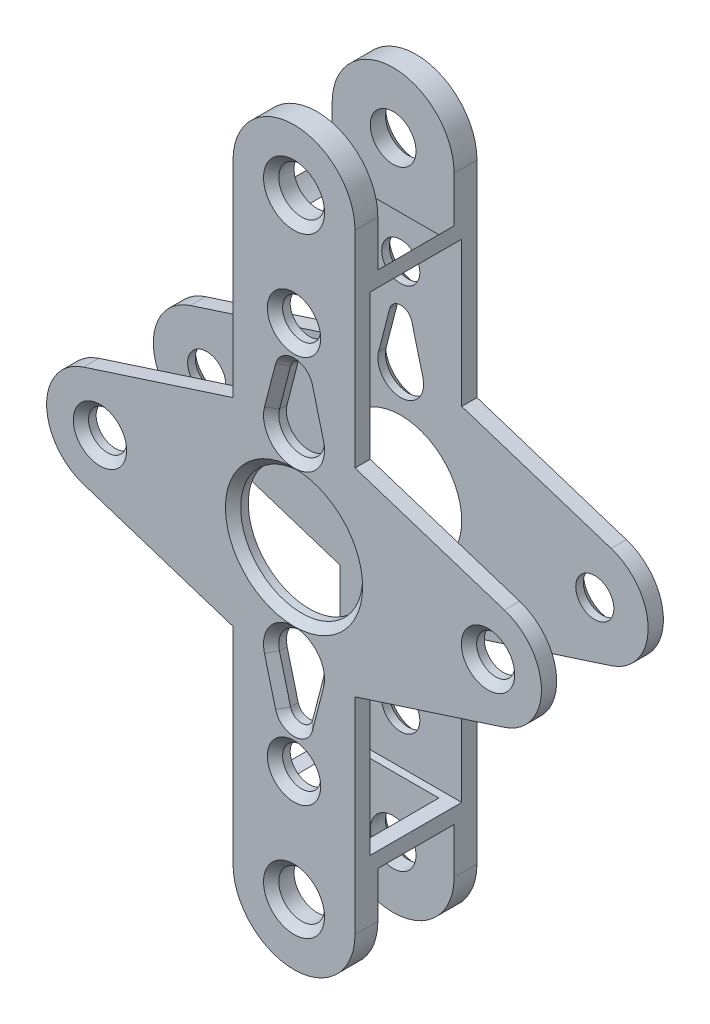
from build123d import *

# Parameters (mm, degrees)
SKETCH_1_R               = 1.25
SKETCH_1_R_2             = 1.5
EXTRUDE_1_DEPTH          = 4
SKETCH_2_R               = 4
CUT_EXTRUDE_1_DEPTH      = 31.055705855
CHAMFER_1_SIZE           = 0.5
SKETCH_3_R               = 5
CUT_EXTRUDE_2_DEPTH      = 2.5
CUT_EXTRUDE_4_DEPTH      = 30.246289584
CUT_EXTRUDE_4_DEPTH_BACK = 30.246289584
SKETCH_7_W               = 6
SKETCH_7_H               = 32


with BuildPart() as part:
    # 草图1 → 凸台-拉伸1 (new, symmetric)
    with BuildSketch(Plane.XY):
        with BuildLine():
            Line((-4, 20), (-4, 6.5))
            Line((-4, 6.5), (-13.804568476, 3.330290152))
            ThreePointArc((-13.804568476, 3.330290152), (-16.227922061, 0), (-13.804568476, -3.330290152))
            Line((-13.804568476, -3.330290152), (-4, -6.5))
            Line((-4, -6.5), (-4, -20))
            ThreePointArc((-4, -20), (0, -24), (4, -20))
            Line((4, -20), (4, -6.5))
            Line((4, -6.5), (13.804568476, -3.330290152))
            ThreePointArc((13.804568476, -3.330290152), (16.227922061, 0), (13.804568476, 3.330290152))
            Line((13.804568476, 3.330290152), (4, 6.5))
            Line((4, 6.5), (4, 20))
            ThreePointArc((4, 20), (0, 24), (-4, 20))
        make_face()
        with Locations((0, 12.727922061)):
            Circle(SKETCH_1_R, mode=Mode.SUBTRACT)
        with Locations((0, -12.727922061)):
            Circle(SKETCH_1_R, mode=Mode.SUBTRACT)
        with Locations((-12.727922061, 0)):
            Circle(SKETCH_1_R, mode=Mode.SUBTRACT)
        with Locations((12.727922061, 0)):
            Circle(SKETCH_1_R, mode=Mode.SUBTRACT)
        with Locations((0, 20)):
            Circle(SKETCH_1_R_2, mode=Mode.SUBTRACT)
        with Locations((0, -20)):
            Circle(SKETCH_1_R_2, mode=Mode.SUBTRACT)
    extrude(amount=EXTRUDE_1_DEPTH, both=True)

    # 草图2 → 切除-拉伸1 (cut, through all)
    with BuildSketch(Plane.XY.offset(4)):
        Circle(SKETCH_2_R)
        with BuildLine():
            Line((-0.726184377, 9.6875), (-1.452368755, 6.875))
            ThreePointArc((-1.452368755, 6.875), (0, 5), (1.452368755, 6.875))
            Line((1.452368755, 6.875), (0.726184377, 9.6875))
            ThreePointArc((0.726184377, 9.6875), (0, 10.25), (-0.726184377, 9.6875))
        make_face()
        with BuildLine():
            Line((-0.726184377, -9.6875), (-1.452368755, -6.875))
            ThreePointArc((-1.452368755, -6.875), (0, -5), (1.452368755, -6.875))
            Line((1.452368755, -6.875), (0.726184377, -9.6875))
            ThreePointArc((0.726184377, -9.6875), (0, -10.25), (-0.726184377, -9.6875))
        make_face()
    extrude(amount=-CUT_EXTRUDE_1_DEPTH, mode=Mode.SUBTRACT)

    # 倒角1
    chamfer_1_edges = [part.edges().sort_by_distance(p)[0] for p in [
        (-1.25, 12.727922061, -4),
        (-1.25, 12.727922061, 4),
        (-1.25, -12.727922061, -4),
        (-1.25, -12.727922061, 4),
        (-1.5, 20, -4),
        (-1.5, 20, 4),
        (11.477922061, 0, -4),
        (11.477922061, 0, 4),
        (-13.977922061, 0, -4),
        (-13.977922061, 0, 4),
        (-1.5, -20, -4),
        (-1.5, -20, 4),
        (0, 10.25, -4),
        (1.089276566, 8.28125, -4),
        (0, 5, -4),
        (-1.089276566, 8.28125, -4),
        (0, 10.25, 4),
        (-1.089276566, 8.28125, 4),
        (0, 5, 4),
        (1.089276566, 8.28125, 4),
        (0, -5, -4),
        (1.089276566, -8.28125, -4),
        (0, -10.25, -4),
        (-1.089276566, -8.28125, -4),
        (0, -5, 4),
        (-1.089276566, -8.28125, 4),
        (0, -10.25, 4),
        (1.089276566, -8.28125, 4),
        (-4, 0, -4),
        (-4, 0, 4),
    ]]
    chamfer(chamfer_1_edges, length=CHAMFER_1_SIZE - 0.0001)  # a hair under: the kernel refuses the full size

    # 草图3 → 切除-拉伸2 (cut, symmetric)
    with BuildSketch(Plane.XY):
        with Locations((0, 20)):
            Circle(SKETCH_3_R)
        with Locations((0, -20)):
            Circle(SKETCH_3_R)
    extrude(amount=CUT_EXTRUDE_2_DEPTH, both=True, mode=Mode.SUBTRACT)

    # 草图7 → 切除-拉伸4 (cut, two sides: drawn at the far end of the back side and taken through both)
    with BuildSketch(Plane(origin=(0, 0, 0), x_dir=(0, 0, -1), z_dir=(1, 0, 0)).offset(-CUT_EXTRUDE_4_DEPTH_BACK)):
        Rectangle(SKETCH_7_W, SKETCH_7_H)
    extrude(amount=CUT_EXTRUDE_4_DEPTH + CUT_EXTRUDE_4_DEPTH_BACK, mode=Mode.SUBTRACT)


solid = part.part
